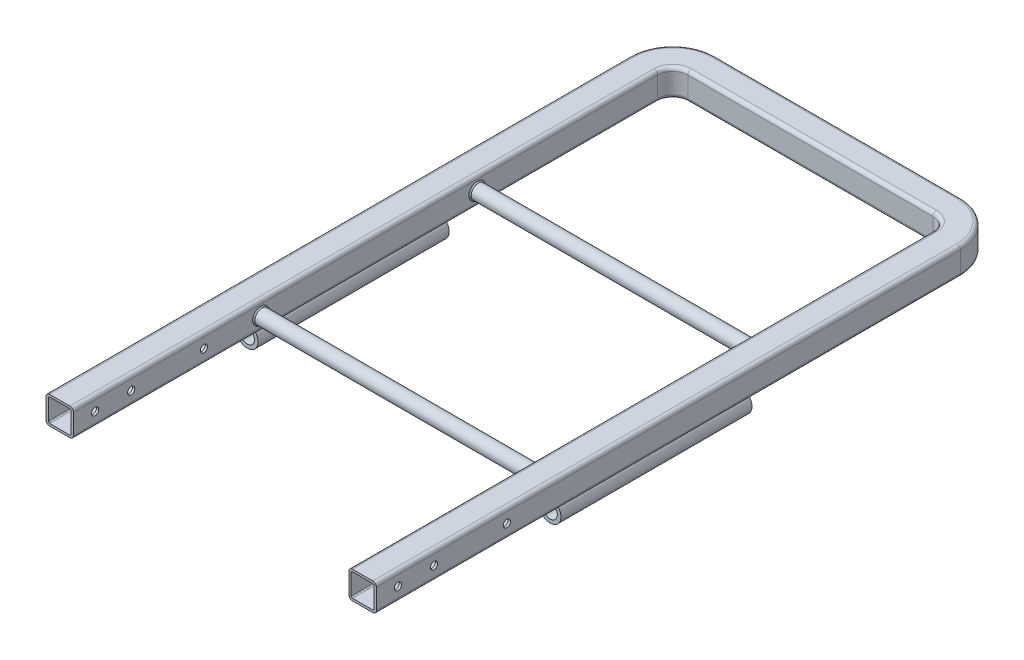
from build123d import *

# Parameters (mm, degrees)
CUT_EXTRUDE2_DEPTH      = 974.845833675
CUT_EXTRUDE2_DEPTH_BACK = 974.845833675
SKETCH4_R               = 5
BOSS_EXTRUDE1_REACH     = 967.407
SKETCH10_R              = 10
SKETCH10_R_2            = 7
CHAMFER1_SIZE           = 1.5
SKETCH24_R              = 15
SKETCH24_R_2            = 10
BOSS_EXTRUDE2_DEPTH     = 265
CHAMFER2_SIZE           = 2.044647147
MIRROR1_START           = -525
MIRROR1_OUTLINE_R       = 10
MIRROR1_DEPTH           = 265


with BuildPart() as part:
    # Sweep-Thin1: sweep along a path in Sketch1
    with BuildLine(Plane(origin=(0, 0, 0), x_dir=(1, 0, 0), z_dir=(0, 1, 0))) as sweep_thin1_path:
        Line((0, 0), (0, 810))
        ThreePointArc((0, 810), (11.715728753, 838.284271247), (40, 850))
        Line((40, 850), (380, 850))
        ThreePointArc((380, 850), (408.284271247, 838.284271247), (420, 810))
        Line((420, 810), (420, 0))
    # Sketch3 → Sweep-Thin1 (sweep)
    with BuildSketch(Plane.XY):
        with BuildLine():
            Line((14.05, 19.05), (-14.05, 19.05))
            ThreePointArc((-14.05, 19.05), (-17.585533906, 17.585533906), (-19.05, 14.05))
            Line((-19.05, 14.05), (-19.05, -14.05))
            ThreePointArc((-19.05, -14.05), (-17.585533906, -17.585533906), (-14.05, -19.05))
            Line((-14.05, -19.05), (14.05, -19.05))
            ThreePointArc((14.05, -19.05), (17.585533906, -17.585533906), (19.05, -14.05))
            Line((19.05, -14.05), (19.05, 14.05))
            ThreePointArc((19.05, 14.05), (17.585533906, 17.585533906), (14.05, 19.05))
        make_face()
        with BuildLine():
            Line((14.05, 15.875), (-14.05, 15.875))
            ThreePointArc((-14.05, 15.875), (-15.340469876, 15.340469876), (-15.875, 14.05))
            Line((-15.875, 14.05), (-15.875, -14.05))
            ThreePointArc((-15.875, -14.05), (-15.340469876, -15.340469876), (-14.05, -15.875))
            Line((-14.05, -15.875), (14.05, -15.875))
            ThreePointArc((14.05, -15.875), (15.340469876, -15.340469876), (15.875, -14.05))
            Line((15.875, -14.05), (15.875, 14.05))
            ThreePointArc((15.875, 14.05), (15.340469876, 15.340469876), (14.05, 15.875))
        make_face(mode=Mode.SUBTRACT)
    sweep(path=sweep_thin1_path.line)

    # Sketch4 → Cut-Extrude2 (cut, two sides: drawn at the far end of the back side and taken through both)
    with BuildSketch(Plane(origin=(0, 0, 0), x_dir=(0, 0, -1), z_dir=(1, 0, 0)).offset(-CUT_EXTRUDE2_DEPTH_BACK)):
        with Locations((30, 0)):
            Circle(SKETCH4_R)
        with Locations((80, 0)):
            Circle(SKETCH4_R)
        with Locations((180.955115779, 0)):
            Circle(SKETCH4_R)
    extrude(amount=CUT_EXTRUDE2_DEPTH + CUT_EXTRUDE2_DEPTH_BACK, mode=Mode.SUBTRACT)

    # Sketch10 → Boss-Extrude1 (add, up to next)
    with BuildSketch(Plane.ZY.offset(-400.95), mode=Mode.PRIVATE) as boss_extrude1_sk1:
        with Locations(Location((-560, 0, 0), (0, 0, 180))):
            Circle(SKETCH10_R)
        with Locations(Location((-560, 0, 0), (0, 0, 180))):
            Circle(SKETCH10_R_2, mode=Mode.SUBTRACT)
    boss_extrude1_tool1 = extrude(boss_extrude1_sk1.sketch, amount=BOSS_EXTRUDE1_REACH, mode=Mode.PRIVATE) - part.part
    # Sketch10 → Boss-Extrude1 (add, up to next)
    with BuildSketch(Plane.ZY.offset(-400.95), mode=Mode.PRIVATE) as boss_extrude1_sk2:
        with Locations(Location((-260, 0, 0), (0, 0, 180))):
            Circle(SKETCH10_R)
        with Locations(Location((-260, 0, 0), (0, 0, 180))):
            Circle(SKETCH10_R_2, mode=Mode.SUBTRACT)
    boss_extrude1_tool2 = extrude(boss_extrude1_sk2.sketch, amount=BOSS_EXTRUDE1_REACH, mode=Mode.PRIVATE) - part.part
    add(boss_extrude1_tool1.solids().sort_by_distance((400.95, 0, -550.282843))[0])
    add(boss_extrude1_tool2.solids().sort_by_distance((400.95, 0, -250.282843))[0])

    # Chamfer1
    chamfer1_edges = [part.edges().sort_by_distance(p)[0] for p in [
        (400.95, 0, -550),
        (19.05, 0, -550),
        (400.95, 0, -250),
        (19.05, 0, -250),
    ]]
    chamfer(chamfer1_edges, length=CHAMFER1_SIZE)

    # Sketch24 → Boss-Extrude2 (add)
    with BuildSketch(Plane.XY.offset(-260)):
        with Locations((420, -33.55)):
            Circle(SKETCH24_R)
        with Locations((420, -33.55)):
            Circle(SKETCH24_R_2, mode=Mode.SUBTRACT)
    extrude(amount=-BOSS_EXTRUDE2_DEPTH)

    # Chamfer2
    # the kernel refuses this chamfer: 2.5, 2.044647147 mm, written as the material it adds along each edge
    with BuildSketch(Plane(origin=(423.840572874, -19.05, -525), x_dir=(1, 0, 0), z_dir=(0, 0, 1))) as chamfer2_piece_1:
        with BuildLine():
            Line((CHAMFER2_SIZE, 0), (2.598026583, -0.952142714))
            ThreePointArc((2.598026583, -0.952142714), (1.357346607, -0.429405376), (0, 0))
            Line((0, 0), (CHAMFER2_SIZE, 0))
        make_face()
    extrude(amount=265)
    with BuildSketch(Plane(origin=(416.159427126, -19.05, -525), x_dir=(-1, 0, 0), z_dir=(0, 0, 1))) as chamfer2_piece_2:
        with BuildLine():
            Line((CHAMFER2_SIZE, 0), (2.598026583, 0.952142714))
            ThreePointArc((2.598026583, 0.952142714), (1.357346607, 0.429405376), (0, 0))
            Line((0, 0), (CHAMFER2_SIZE, 0))
        make_face()
    extrude(amount=265)

    # Mirror1: read off the stored shape, not the designer's step
    # Mirror1 outline → Mirror1 (add)
    with BuildSketch(Plane.XY.offset(MIRROR1_START)):
        with BuildLine():
            Line((-6.340572874, -19.05), (-8.440985911, -21.150413037))
            ThreePointArc((-8.440985911, -21.150413037), (0, -48.55), (8.440985911, -21.150413037))
            Line((8.440985911, -21.150413037), (6.340572874, -19.05))
            Line((6.340572874, -19.05), (-6.340572874, -19.05))
        make_face()
        with Locations((0, -33.55)):
            Circle(MIRROR1_OUTLINE_R, mode=Mode.SUBTRACT)
    extrude(amount=MIRROR1_DEPTH)


solid = part.part
